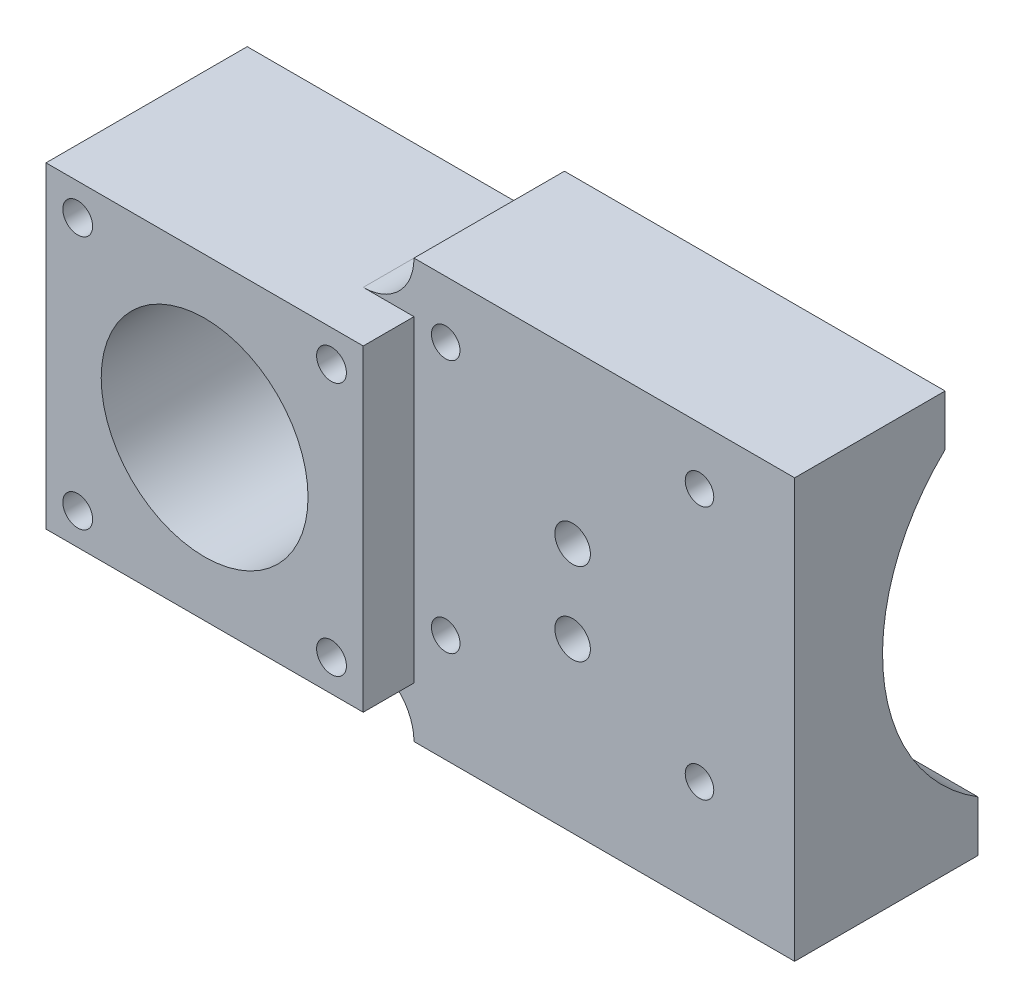
from build123d import *
from build123d.topology import SkipClean

# Parameters (mm, degrees)
SKETCH1_W               = 50
SKETCH1_H               = 50
SKETCH1_R               = 16.3
SKETCH1_R_2             = 2.35
BOSS_EXTRUDE1_DEPTH     = 53.6
CUT_EXTRUDE1_DEPTH      = 66.015075175
CUT_EXTRUDE1_DEPTH_BACK = 66.015075175
SKETCH2_R               = 31.75
BOSS_EXTRUDE3_START     = 60
BOSS_EXTRUDE3_DEPTH     = 60
SKETCH12_W              = 60
SKETCH12_H              = 66
CUT_EXTRUDE7_DEPTH      = 8
CUT_EXTRUDE5_DEPTH      = 107.409398132
CUT_EXTRUDE5_DEPTH_BACK = 107.409398132
SKETCH9_R               = 2.25
CUT_EXTRUDE6_DEPTH      = 97.358246028
CUT_EXTRUDE6_DEPTH_BACK = 10
SKETCH10_R              = 2.8
FILLET1_R               = 8


with BuildPart() as part:
    # Sketch1 → Boss-Extrude1 (new body)
    with BuildSketch(Plane.XY):
        with Locations((0, -2)):
            Rectangle(SKETCH1_W, SKETCH1_H)
        with Locations((0, -2)):
            Circle(SKETCH1_R, mode=Mode.SUBTRACT)
        with Locations((-20, 18)):
            Circle(SKETCH1_R_2, mode=Mode.SUBTRACT)
        with Locations((20, 18)):
            Circle(SKETCH1_R_2, mode=Mode.SUBTRACT)
        with Locations((20, -22)):
            Circle(SKETCH1_R_2, mode=Mode.SUBTRACT)
        with Locations((-20, -22)):
            Circle(SKETCH1_R_2, mode=Mode.SUBTRACT)
    extrude(amount=BOSS_EXTRUDE1_DEPTH)

    # Sketch2 → Cut-Extrude1 (cut, two sides: drawn at the far end of the back side and taken through both)
    with BuildSketch(Plane(origin=(0, 0, 0), x_dir=(0, 0, -1), z_dir=(1, 0, 0)).offset(-CUT_EXTRUDE1_DEPTH_BACK)):
        Circle(SKETCH2_R)
    extrude(amount=CUT_EXTRUDE1_DEPTH + CUT_EXTRUDE1_DEPTH_BACK, mode=Mode.SUBTRACT)

    # Sketch4 → Boss-Extrude3 (add)
    with SkipClean():  # the faces are left unmerged after this step: merging them gives an invalid solid
        with BuildSketch(Plane(origin=(25, 0, 0), x_dir=(0, 0, -1), z_dir=(1, 0, 0)).offset(BOSS_EXTRUDE3_START)):
            with BuildLine():
                Line((-53.6, -27), (-53.6, -35))
                Line((-53.6, -35), (-16.705163872, -35))
                Line((-16.705163872, -35), (-16.705163872, -27))
                ThreePointArc((-16.705163872, -27), (-31.580822619, -3.273246506), (-21.887496431, 23))
                Line((-21.887496431, 23), (-21.887496431, 31))
                Line((-21.887496431, 31), (-53.6, 31))
                Line((-53.6, 31), (-53.6, 23))
                Line((-53.6, 23), (-53.6, -27))
            make_face()
        extrude(amount=-BOSS_EXTRUDE3_DEPTH)

    # Sketch12 → Cut-Extrude7 (cut)
    with SkipClean():  # the faces are left unmerged after this step: merging them gives an invalid solid
        with BuildSketch(Plane.XY.offset(53.6)):
            with Locations((55, -2)):
                Rectangle(SKETCH12_W, SKETCH12_H)
        extrude(amount=-CUT_EXTRUDE7_DEPTH, mode=Mode.SUBTRACT)

    # Sketch9 → Cut-Extrude5 (cut, two sides: drawn at the far end of the back side and taken through both)
    with SkipClean():  # the faces are left unmerged after this step: merging them gives an invalid solid
        with BuildSketch(Plane.XY.offset(-CUT_EXTRUDE5_DEPTH_BACK)):
            with Locations(Location((30, 22, 0), (0, 0, 153.612200039))):
                Circle(SKETCH9_R)
            with Locations(Location((70, 22, 0), (0, 0, 153.612200039))):
                Circle(SKETCH9_R)
            with Locations(Location((70, -18, 0), (0, 0, 180))):
                Circle(SKETCH9_R)
            with Locations(Location((30, -18, 0), (0, 0, 180))):
                Circle(SKETCH9_R)
        extrude(amount=CUT_EXTRUDE5_DEPTH + CUT_EXTRUDE5_DEPTH_BACK, mode=Mode.SUBTRACT)

    # Sketch10 → Cut-Extrude6 (cut, two sides: drawn at the far end of the back side and taken through both)
    with SkipClean():  # the faces are left unmerged after this step: merging them gives an invalid solid
        with BuildSketch(Plane.XY.offset(45.6).offset(-CUT_EXTRUDE6_DEPTH_BACK)):
            with Locations((50, 4.5)):
                Circle(SKETCH10_R)
            with Locations((50, -8.5)):
                Circle(SKETCH10_R)
        extrude(amount=CUT_EXTRUDE6_DEPTH + CUT_EXTRUDE6_DEPTH_BACK, mode=Mode.SUBTRACT)

    # Fillet1
    # the kernel refuses this fillet: 8 mm, written as the material it adds along each edge
    with BuildSketch(Plane(origin=(25, 23, 21.887496431), x_dir=(-1, 0, 0), z_dir=(0, 0, 1))) as fillet1_piece_1:
        with BuildLine():
            CenterArc((FILLET1_R, -FILLET1_R), FILLET1_R, 90, 90)
            Line((0, -FILLET1_R), (0, 0))
            Line((0, 0), (FILLET1_R, 0))
        make_face()
    extrude(amount=23.712503569)
    with BuildSketch(Plane(origin=(25, -27, 16.705163872), x_dir=(-1, 0, 0), z_dir=(0, 0, 1))) as fillet1_piece_2:
        with BuildLine():
            CenterArc((FILLET1_R, FILLET1_R), FILLET1_R, 180, 90)
            Line((0, FILLET1_R), (0, 0))
            Line((0, 0), (FILLET1_R, 0))
        make_face()
    extrude(amount=28.894836128)


solid = part.part
